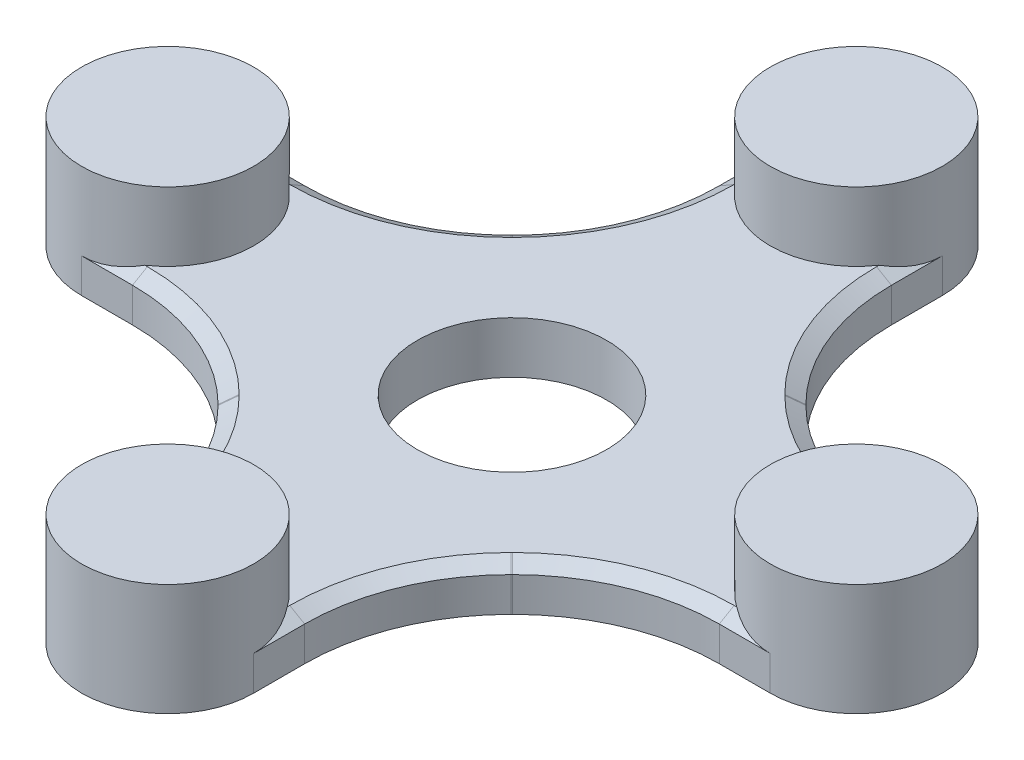
from build123d import *

# Parameters (mm, degrees)
BOSS_EXTRUDE2_DEPTH = 3
SKETCH3_R           = 5
BOSS_EXTRUDE3_DEPTH = 4
FILLET2_R           = 12
CUT_EXTRUDE1_REACH  = 37.581
SKETCH4_R           = 5.5
CHAMFER1_SIZE       = 0.866025404
CHAMFER1_SIZE_2     = 0.5


with BuildPart() as part:
    # Sketch2 → Boss-Extrude2 (new body)
    with BuildSketch(Plane(origin=(0, 0, 0), x_dir=(1, 0, 0), z_dir=(0, 1, 0))):
        Polygon((-5, 25), (-5, 12.071067812), (-12.071067812, 5), (-25, 5), (-25, -5), (-12.071067812, -5), (-5, -12.071067812), (-5, -25), (5, -25), (5, -12.071067812), (12.071067812, -5), (25, -5), (25, 5), (12.071067812, 5), (5, 12.071067812), (5, 25), align=None)
    extrude(amount=BOSS_EXTRUDE2_DEPTH)

    # Sketch3 → Boss-Extrude3 (add)
    with BuildSketch(Plane(origin=(0, 3, 0), x_dir=(1, 0, 0), z_dir=(0, 1, 0))):
        with Locations(Location((-20, 0, 0), (0, 0, 270))):
            Circle(SKETCH3_R)
        with Locations(Location((0, 20, 0), (0, 0, 90))):
            Circle(SKETCH3_R)
        with Locations(Location((20, 0, 0), (0, 0, 270))):
            Circle(SKETCH3_R)
        with Locations(Location((0, -20, 0), (0, 0, 270))):
            Circle(SKETCH3_R)
    extrude(amount=BOSS_EXTRUDE3_DEPTH)

    # Fillet2
    fillet2_edges = [part.edges().sort_by_distance(p)[0] for p in [
        (5, 1.5, -12.071067812),
        (12.071067812, 1.5, -5),
        (12.071067812, 1.5, 5),
        (5, 1.5, 12.071067812),
        (-5, 1.5, 12.071067812),
        (-12.071067812, 1.5, 5),
        (-12.071067812, 1.5, -5),
        (-5, 1.5, -12.071067812),
    ]]
    fillet(fillet2_edges, radius=FILLET2_R)

    # Sketch4 → Cut-Extrude1 (cut, up to next)
    with BuildSketch(Plane(origin=(0, 3, 0), x_dir=(1, 0, 0), z_dir=(0, 1, 0)), mode=Mode.PRIVATE) as cut_extrude1_sk1:
        with BuildLine():
            ThreePointArc((-25, 0), (-23.535533906, -3.535533906), (-20, -5))
            Line((-20, -5), (-25, -5))
            Line((-25, -5), (-25, 0))
        make_face()
    cut_extrude1_tool1 = extrude(cut_extrude1_sk1.sketch, amount=-CUT_EXTRUDE1_REACH, mode=Mode.PRIVATE) & part.part
    # Sketch4 → Cut-Extrude1 (cut, up to next)
    with BuildSketch(Plane(origin=(0, 3, 0), x_dir=(1, 0, 0), z_dir=(0, 1, 0)), mode=Mode.PRIVATE) as cut_extrude1_sk2:
        with BuildLine():
            ThreePointArc((-20, 5), (-23.535533906, 3.535533906), (-25, 0))
            Line((-25, 0), (-25, 5))
            Line((-25, 5), (-20, 5))
        make_face()
    cut_extrude1_tool2 = extrude(cut_extrude1_sk2.sketch, amount=-CUT_EXTRUDE1_REACH, mode=Mode.PRIVATE) & part.part
    # Sketch4 → Cut-Extrude1 (cut, up to next)
    with BuildSketch(Plane(origin=(0, 3, 0), x_dir=(1, 0, 0), z_dir=(0, 1, 0)), mode=Mode.PRIVATE) as cut_extrude1_sk3:
        with BuildLine():
            ThreePointArc((0, 25), (-3.535533906, 23.535533906), (-5, 20))
            Line((-5, 20), (-5, 25))
            Line((-5, 25), (0, 25))
        make_face()
    cut_extrude1_tool3 = extrude(cut_extrude1_sk3.sketch, amount=-CUT_EXTRUDE1_REACH, mode=Mode.PRIVATE) & part.part
    # Sketch4 → Cut-Extrude1 (cut, up to next)
    with BuildSketch(Plane(origin=(0, 3, 0), x_dir=(1, 0, 0), z_dir=(0, 1, 0)), mode=Mode.PRIVATE) as cut_extrude1_sk4:
        with BuildLine():
            ThreePointArc((5, 20), (3.535533906, 23.535533906), (0, 25))
            Line((0, 25), (5, 25))
            Line((5, 25), (5, 20))
        make_face()
    cut_extrude1_tool4 = extrude(cut_extrude1_sk4.sketch, amount=-CUT_EXTRUDE1_REACH, mode=Mode.PRIVATE) & part.part
    # Sketch4 → Cut-Extrude1 (cut, up to next)
    with BuildSketch(Plane(origin=(0, 3, 0), x_dir=(1, 0, 0), z_dir=(0, 1, 0)), mode=Mode.PRIVATE) as cut_extrude1_sk5:
        with BuildLine():
            ThreePointArc((25, 0), (23.535533906, 3.535533906), (20, 5))
            Line((20, 5), (25, 5))
            Line((25, 5), (25, 0))
        make_face()
    cut_extrude1_tool5 = extrude(cut_extrude1_sk5.sketch, amount=-CUT_EXTRUDE1_REACH, mode=Mode.PRIVATE) & part.part
    # Sketch4 → Cut-Extrude1 (cut, up to next)
    with BuildSketch(Plane(origin=(0, 3, 0), x_dir=(1, 0, 0), z_dir=(0, 1, 0)), mode=Mode.PRIVATE) as cut_extrude1_sk6:
        with BuildLine():
            ThreePointArc((20, -5), (23.535533906, -3.535533906), (25, 0))
            Line((25, 0), (25, -5))
            Line((25, -5), (20, -5))
        make_face()
    cut_extrude1_tool6 = extrude(cut_extrude1_sk6.sketch, amount=-CUT_EXTRUDE1_REACH, mode=Mode.PRIVATE) & part.part
    # Sketch4 → Cut-Extrude1 (cut, up to next)
    with BuildSketch(Plane(origin=(0, 3, 0), x_dir=(1, 0, 0), z_dir=(0, 1, 0)), mode=Mode.PRIVATE) as cut_extrude1_sk7:
        with BuildLine():
            ThreePointArc((0, -25), (3.535533906, -23.535533906), (5, -20))
            Line((5, -20), (5, -25))
            Line((5, -25), (0, -25))
        make_face()
    cut_extrude1_tool7 = extrude(cut_extrude1_sk7.sketch, amount=-CUT_EXTRUDE1_REACH, mode=Mode.PRIVATE) & part.part
    # Sketch4 → Cut-Extrude1 (cut, up to next)
    with BuildSketch(Plane(origin=(0, 3, 0), x_dir=(1, 0, 0), z_dir=(0, 1, 0)), mode=Mode.PRIVATE) as cut_extrude1_sk8:
        with BuildLine():
            ThreePointArc((-5, -20), (-3.535533906, -23.535533906), (0, -25))
            Line((0, -25), (-5, -25))
            Line((-5, -25), (-5, -20))
        make_face()
    cut_extrude1_tool8 = extrude(cut_extrude1_sk8.sketch, amount=-CUT_EXTRUDE1_REACH, mode=Mode.PRIVATE) & part.part
    # Sketch4 → Cut-Extrude1 (cut, up to next)
    with BuildSketch(Plane(origin=(0, 3, 0), x_dir=(1, 0, 0), z_dir=(0, 1, 0)), mode=Mode.PRIVATE) as cut_extrude1_sk9:
        with Locations(Location((0, 0, 0), (0, 0, 270))):
            Circle(SKETCH4_R)
    cut_extrude1_tool9 = extrude(cut_extrude1_sk9.sketch, amount=-CUT_EXTRUDE1_REACH, mode=Mode.PRIVATE) & part.part
    add(cut_extrude1_tool1.solids().sort_by_distance((-23.88316, 3, 3.88316))[0], mode=Mode.SUBTRACT)
    add(cut_extrude1_tool2.solids().sort_by_distance((-23.88316, 3, -3.88316))[0], mode=Mode.SUBTRACT)
    add(cut_extrude1_tool3.solids().sort_by_distance((-3.88316, 3, -23.88316))[0], mode=Mode.SUBTRACT)
    add(cut_extrude1_tool4.solids().sort_by_distance((3.88316, 3, -23.88316))[0], mode=Mode.SUBTRACT)
    add(cut_extrude1_tool5.solids().sort_by_distance((23.88316, 3, -3.88316))[0], mode=Mode.SUBTRACT)
    add(cut_extrude1_tool6.solids().sort_by_distance((23.88316, 3, 3.88316))[0], mode=Mode.SUBTRACT)
    add(cut_extrude1_tool7.solids().sort_by_distance((3.88316, 3, 23.88316))[0], mode=Mode.SUBTRACT)
    add(cut_extrude1_tool8.solids().sort_by_distance((-3.88316, 3, 23.88316))[0], mode=Mode.SUBTRACT)
    add(cut_extrude1_tool9.solids().sort_by_distance((0, 3, 0))[0], mode=Mode.SUBTRACT)

    # Chamfer1
    # the kernel refuses this chamfer: 0.866025404, 0.5 mm, written as the material it takes off along each edge
    with BuildSketch(Plane(origin=(17.04163056, 3, 17), x_dir=(-0.7071067811865476, 0, -0.7071067811865475), z_dir=(-0.7071067811865475, 0, 0.7071067811865476))) as chamfer1_piece_1:
        Polygon((12 + CHAMFER1_SIZE, 0), (12, CHAMFER1_SIZE_2), (12, 0), align=None)
    revolve(axis=Axis((17.04163056, 3, 17), (0, -1, 0)), revolution_arc=45, mode=Mode.SUBTRACT)
    with BuildSketch(Plane(origin=(17.04163056, 0, 17), x_dir=(-0.7071067811865476, 0, -0.7071067811865475), z_dir=(-0.7071067811865475, 0, 0.7071067811865476))) as chamfer1_piece_2:
        Polygon((12 + CHAMFER1_SIZE, 0), (12, -CHAMFER1_SIZE_2), (12, 0), align=None)
    revolve(axis=Axis((17.04163056, 0, 17), (0, -1, 0)), revolution_arc=45, mode=Mode.SUBTRACT)
    with BuildSketch(Plane(origin=(17, 0, 17.04163056), x_dir=(-1, 0, 0), z_dir=(0, 0, 1))) as chamfer1_piece_3:
        Polygon((12 + CHAMFER1_SIZE, 0), (12, -CHAMFER1_SIZE_2), (12, 0), align=None)
    revolve(axis=Axis((17, 0, 17.04163056), (0, -1, 0)), revolution_arc=45, mode=Mode.SUBTRACT)
    with BuildSketch(Plane(origin=(17, 3, 17.04163056), x_dir=(-1, 0, 0), z_dir=(0, 0, 1))) as chamfer1_piece_4:
        Polygon((12 + CHAMFER1_SIZE, 0), (12, CHAMFER1_SIZE_2), (12, 0), align=None)
    revolve(axis=Axis((17, 3, 17.04163056), (0, -1, 0)), revolution_arc=45, mode=Mode.SUBTRACT)
    with BuildSketch(Plane(origin=(5, 0, 20), x_dir=(-0.9998132206222079, -0.019326765612700636, 0), z_dir=(0, 0, -1)), Plane(origin=(-20, 0, 5), x_dir=(0, -0.019326765612700636, -0.9998132206222079), z_dir=(1, 0, 0)), Plane(origin=(20, 0, -5), x_dir=(0, -0.019326765612700636, 0.9998132206222079), z_dir=(-1, 0, 0)), Plane(origin=(-5, 0, 17.04163056), x_dir=(0.9998132206222079, -0.019326765612700636, 0), z_dir=(0, 0, 1)), Plane(origin=(-17.04163056, 0, -5), x_dir=(0, -0.019326765612700636, 0.9998132206222079), z_dir=(-1, 0, 0)), Plane(origin=(5, 0, -17.04163056), x_dir=(-0.9998132206222079, -0.019326765612700636, 0), z_dir=(0, 0, -1)), Plane(origin=(17.04163056, 0, 5), x_dir=(0, -0.019326765612700636, -0.9998132206222079), z_dir=(1, 0, 0))) as chamfer1_piece_5:
        Polygon((CHAMFER1_SIZE * 0.999813220373, CHAMFER1_SIZE * 0.0193267656079), (-CHAMFER1_SIZE_2 * 0.0193267656127, CHAMFER1_SIZE_2 * 0.999813220622), (0, 0), align=None)
    extrude(amount=2.95836944, mode=Mode.SUBTRACT)
    with BuildSketch(Plane(origin=(5, 3, 22.240481985), x_dir=(-0.9998132206222079, 0.019326765612700702, 0), z_dir=(0, 0, -1))) as chamfer1_piece_6_section:
        Polygon((CHAMFER1_SIZE * 0.999813220373, -CHAMFER1_SIZE * 0.0193267656079), (-CHAMFER1_SIZE_2 * 0.0193267656127, -CHAMFER1_SIZE_2 * 0.999813220622), (0, 0), align=None)
    chamfer1_piece_6 = extrude(amount=5.198851425, mode=Mode.PRIVATE)
    chamfer1_piece_6 = chamfer1_piece_6 - Plane(origin=(0, 2.808146468, 20), x_dir=(0, 0, 1), z_dir=(0, 1, 0)) * Cylinder(5, 14, mode=Mode.PRIVATE)
    add(chamfer1_piece_6, mode=Mode.SUBTRACT)
    with BuildSketch(Plane(origin=(-5, 0, -20), x_dir=(-0.057893862402671484, 0.9983227437537926, 0), z_dir=(0, 0, 1))) as chamfer1_piece_7:
        Polygon((CHAMFER1_SIZE_2 * 0.998322743754, -CHAMFER1_SIZE_2 * 0.0578938624027), (-CHAMFER1_SIZE * 0.0578938623883, -CHAMFER1_SIZE * 0.998322743505), (0, 0), align=None)
    extrude(amount=2.95836944, mode=Mode.SUBTRACT)
    with BuildSketch(Plane(origin=(-5, 3, -22.240481983), x_dir=(-0.05789386240267147, -0.9983227437537926, 0), z_dir=(0, 0, 1))) as chamfer1_piece_8_section:
        Polygon((CHAMFER1_SIZE_2 * 0.998322743754, CHAMFER1_SIZE_2 * 0.0578938624027), (-CHAMFER1_SIZE * 0.0578938623883, CHAMFER1_SIZE * 0.998322743505), (0, 0), align=None)
    chamfer1_piece_8 = extrude(amount=5.198851422, mode=Mode.PRIVATE)
    chamfer1_piece_8 = chamfer1_piece_8 - Plane(origin=(0, 2.808146468, -20), x_dir=(0, 0, -1), z_dir=(0, 1, 0)) * Cylinder(5, 14, mode=Mode.PRIVATE)
    add(chamfer1_piece_8, mode=Mode.SUBTRACT)
    with BuildSketch(Plane(origin=(0, 0, 20), x_dir=(-1, 0, 0), z_dir=(0, 0, -1))) as chamfer1_piece_9:
        Polygon((5 - CHAMFER1_SIZE, 0), (5, CHAMFER1_SIZE_2), (5, 0), align=None)
    revolve(axis=Axis((0, 0, 20), (0, 1, 0)), revolution_arc=90, mode=Mode.SUBTRACT)
    with BuildSketch(Plane(origin=(20, 0, 0), x_dir=(0, 0, 1), z_dir=(-1, 0, 0))) as chamfer1_piece_10:
        Polygon((5 - CHAMFER1_SIZE, 0), (5, CHAMFER1_SIZE_2), (5, 0), align=None)
    revolve(axis=Axis((20, 0, 0), (0, 1, 0)), revolution_arc=90, mode=Mode.SUBTRACT)
    with BuildSketch(Plane(origin=(0, 0, -20), x_dir=(1, 0, 0), z_dir=(0, 0, 1))) as chamfer1_piece_11:
        Polygon((5 - CHAMFER1_SIZE, 0), (5, CHAMFER1_SIZE_2), (5, 0), align=None)
    revolve(axis=Axis((0, 0, -20), (0, 1, 0)), revolution_arc=90, mode=Mode.SUBTRACT)
    with BuildSketch(Plane(origin=(-20, 0, 0), x_dir=(0, 0, -1), z_dir=(1, 0, 0))) as chamfer1_piece_12:
        Polygon((5 - CHAMFER1_SIZE, 0), (5, CHAMFER1_SIZE_2), (5, 0), align=None)
    revolve(axis=Axis((-20, 0, 0), (0, 1, 0)), revolution_arc=90, mode=Mode.SUBTRACT)
    with BuildSketch(Plane(origin=(-22.240481985, 3, 5), x_dir=(0, 0.019326765612700702, -0.9998132206222079), z_dir=(1, 0, 0))) as chamfer1_piece_13_section:
        Polygon((CHAMFER1_SIZE * 0.999813220373, -CHAMFER1_SIZE * 0.0193267656079), (-CHAMFER1_SIZE_2 * 0.0193267656127, -CHAMFER1_SIZE_2 * 0.999813220622), (0, 0), align=None)
    chamfer1_piece_13 = extrude(amount=5.198851425, mode=Mode.PRIVATE)
    chamfer1_piece_13 = chamfer1_piece_13 - Plane(origin=(-20, 2.808146468, 0), x_dir=(-1, 0, 0), z_dir=(0, 1, 0)) * Cylinder(5, 14, mode=Mode.PRIVATE)
    add(chamfer1_piece_13, mode=Mode.SUBTRACT)
    with BuildSketch(Plane(origin=(22.240481985, 3, -5), x_dir=(0, 0.019326765612700702, 0.9998132206222079), z_dir=(-1, 0, 0))) as chamfer1_piece_14_section:
        Polygon((CHAMFER1_SIZE * 0.999813220373, -CHAMFER1_SIZE * 0.0193267656079), (-CHAMFER1_SIZE_2 * 0.0193267656127, -CHAMFER1_SIZE_2 * 0.999813220622), (0, 0), align=None)
    chamfer1_piece_14 = extrude(amount=5.198851425, mode=Mode.PRIVATE)
    chamfer1_piece_14 = chamfer1_piece_14 - Plane(origin=(20, 2.808146468, 0), x_dir=(1, 0, 0), z_dir=(0, 1, 0)) * Cylinder(5, 14, mode=Mode.PRIVATE)
    add(chamfer1_piece_14, mode=Mode.SUBTRACT)
    with BuildSketch(Plane(origin=(-8.556349186, 0, 8.514718626), x_dir=(0.7069747082219248, -0.01932676561270064, -0.7069747082219251), z_dir=(0.7071067811865477, 0, 0.7071067811865475)), Plane(origin=(-8.514718626, 0, -8.556349186), x_dir=(0.706974708221925, -0.01932676561270064, 0.706974708221925), z_dir=(-0.7071067811865475, 0, 0.7071067811865476)), Plane(origin=(8.556349186, 0, -8.514718626), x_dir=(-0.706974708221925, -0.01932676561270064, 0.706974708221925), z_dir=(-0.7071067811865476, 0, -0.7071067811865476)), Plane(origin=(8.514718626, 0, 8.556349186), x_dir=(-0.7069747082219248, -0.01932676561270064, -0.7069747082219251), z_dir=(0.7071067811865477, 0, -0.7071067811865475))) as chamfer1_piece_15:
        Polygon((CHAMFER1_SIZE * 0.999813220373, CHAMFER1_SIZE * 0.0193267656079), (-CHAMFER1_SIZE_2 * 0.0193267656127, CHAMFER1_SIZE_2 * 0.999813220622), (0, 0), align=None)
    extrude(amount=0.058874503, mode=Mode.SUBTRACT)
    with BuildSketch(Plane(origin=(-8.556349186, 3, 8.514718626), x_dir=(0.7069747082219248, 0.019326765612700702, -0.7069747082219251), z_dir=(0.7071067811865477, 0, 0.7071067811865475)), Plane(origin=(-8.514718626, 3, -8.556349186), x_dir=(0.706974708221925, 0.019326765612700702, 0.706974708221925), z_dir=(-0.7071067811865475, 0, 0.7071067811865476)), Plane(origin=(8.556349186, 3, -8.514718626), x_dir=(-0.706974708221925, 0.019326765612700702, 0.706974708221925), z_dir=(-0.7071067811865476, 0, -0.7071067811865476)), Plane(origin=(8.514718626, 3, 8.556349186), x_dir=(-0.7069747082219248, 0.019326765612700702, -0.7069747082219251), z_dir=(0.7071067811865477, 0, -0.7071067811865475))) as chamfer1_piece_16:
        Polygon((CHAMFER1_SIZE * 0.999813220373, -CHAMFER1_SIZE * 0.0193267656079), (-CHAMFER1_SIZE_2 * 0.0193267656127, -CHAMFER1_SIZE_2 * 0.999813220622), (0, 0), align=None)
    extrude(amount=0.058874503, mode=Mode.SUBTRACT)
    with BuildSketch(Plane(origin=(-5, 3, 17.04163056), x_dir=(0.9998132206222079, 0.019326765612700702, 0), z_dir=(0, 0, 1))) as chamfer1_piece_17_section:
        Polygon((CHAMFER1_SIZE * 0.999813220373, -CHAMFER1_SIZE * 0.0193267656079), (-CHAMFER1_SIZE_2 * 0.0193267656127, -CHAMFER1_SIZE_2 * 0.999813220622), (0, 0), align=None)
    chamfer1_piece_17 = extrude(amount=5.198851425, mode=Mode.PRIVATE)
    chamfer1_piece_17 = chamfer1_piece_17 - Plane(origin=(0, 2.808146468, 20), x_dir=(-1, 0, 0), z_dir=(0, 1, 0)) * Cylinder(5, 14, mode=Mode.PRIVATE)
    add(chamfer1_piece_17, mode=Mode.SUBTRACT)
    with BuildSketch(Plane(origin=(-17.04163056, 3, -5), x_dir=(0, 0.019326765612700702, 0.9998132206222079), z_dir=(-1, 0, 0))) as chamfer1_piece_18_section:
        Polygon((CHAMFER1_SIZE * 0.999813220373, -CHAMFER1_SIZE * 0.0193267656079), (-CHAMFER1_SIZE_2 * 0.0193267656127, -CHAMFER1_SIZE_2 * 0.999813220622), (0, 0), align=None)
    chamfer1_piece_18 = extrude(amount=5.198851425, mode=Mode.PRIVATE)
    chamfer1_piece_18 = chamfer1_piece_18 - Plane(origin=(-20, 2.808146468, 0), x_dir=(0, 0, -1), z_dir=(0, 1, 0)) * Cylinder(5, 14, mode=Mode.PRIVATE)
    add(chamfer1_piece_18, mode=Mode.SUBTRACT)
    with BuildSketch(Plane(origin=(5, 3, -17.04163056), x_dir=(-0.9998132206222079, 0.019326765612700702, 0), z_dir=(0, 0, -1))) as chamfer1_piece_19_section:
        Polygon((CHAMFER1_SIZE * 0.999813220373, -CHAMFER1_SIZE * 0.0193267656079), (-CHAMFER1_SIZE_2 * 0.0193267656127, -CHAMFER1_SIZE_2 * 0.999813220622), (0, 0), align=None)
    chamfer1_piece_19 = extrude(amount=5.198851425, mode=Mode.PRIVATE)
    chamfer1_piece_19 = chamfer1_piece_19 - Plane(origin=(0, 2.808146468, -20), x_dir=(1, 0, 0), z_dir=(0, 1, 0)) * Cylinder(5, 14, mode=Mode.PRIVATE)
    add(chamfer1_piece_19, mode=Mode.SUBTRACT)
    with BuildSketch(Plane(origin=(17.04163056, 3, 5), x_dir=(0, 0.019326765612700702, -0.9998132206222079), z_dir=(1, 0, 0))) as chamfer1_piece_20_section:
        Polygon((CHAMFER1_SIZE * 0.999813220373, -CHAMFER1_SIZE * 0.0193267656079), (-CHAMFER1_SIZE_2 * 0.0193267656127, -CHAMFER1_SIZE_2 * 0.999813220622), (0, 0), align=None)
    chamfer1_piece_20 = extrude(amount=5.198851425, mode=Mode.PRIVATE)
    chamfer1_piece_20 = chamfer1_piece_20 - Plane(origin=(20, 2.808146468, 0), x_dir=(0, 0, 1), z_dir=(0, 1, 0)) * Cylinder(5, 14, mode=Mode.PRIVATE)
    add(chamfer1_piece_20, mode=Mode.SUBTRACT)
    with BuildSketch(Plane(origin=(-17.04163056, 0, 17), x_dir=(0, 0, -1), z_dir=(-1, 0, 0))) as chamfer1_piece_21:
        Polygon((12 + CHAMFER1_SIZE, 0), (12, -CHAMFER1_SIZE_2), (12, 0), align=None)
    revolve(axis=Axis((-17.04163056, 0, 17), (0, -1, 0)), revolution_arc=45, mode=Mode.SUBTRACT)
    with BuildSketch(Plane(origin=(-17.04163056, 3, 17), x_dir=(0, 0, -1), z_dir=(-1, 0, 0))) as chamfer1_piece_22:
        Polygon((12 + CHAMFER1_SIZE, 0), (12, CHAMFER1_SIZE_2), (12, 0), align=None)
    revolve(axis=Axis((-17.04163056, 3, 17), (0, -1, 0)), revolution_arc=45, mode=Mode.SUBTRACT)
    with BuildSketch(Plane(origin=(-17, 0, 17.04163056), x_dir=(0.7071067811865475, 0, -0.7071067811865476), z_dir=(-0.7071067811865476, 0, -0.7071067811865475))) as chamfer1_piece_23:
        Polygon((12 + CHAMFER1_SIZE, 0), (12, -CHAMFER1_SIZE_2), (12, 0), align=None)
    revolve(axis=Axis((-17, 0, 17.04163056), (0, -1, 0)), revolution_arc=45, mode=Mode.SUBTRACT)
    with BuildSketch(Plane(origin=(-17, 3, 17.04163056), x_dir=(0.7071067811865475, 0, -0.7071067811865476), z_dir=(-0.7071067811865476, 0, -0.7071067811865475))) as chamfer1_piece_24:
        Polygon((12 + CHAMFER1_SIZE, 0), (12, CHAMFER1_SIZE_2), (12, 0), align=None)
    revolve(axis=Axis((-17, 3, 17.04163056), (0, -1, 0)), revolution_arc=45, mode=Mode.SUBTRACT)
    with BuildSketch(Plane(origin=(-17.04163056, 0, -17), x_dir=(0.7071067811865477, 0, 0.7071067811865475), z_dir=(0.7071067811865475, 0, -0.7071067811865477))) as chamfer1_piece_25:
        Polygon((12 + CHAMFER1_SIZE, 0), (12, -CHAMFER1_SIZE_2), (12, 0), align=None)
    revolve(axis=Axis((-17.04163056, 0, -17), (0, -1, 0)), revolution_arc=45, mode=Mode.SUBTRACT)
    with BuildSketch(Plane(origin=(-17.04163056, 3, -17), x_dir=(0.7071067811865477, 0, 0.7071067811865475), z_dir=(0.7071067811865475, 0, -0.7071067811865477))) as chamfer1_piece_26:
        Polygon((12 + CHAMFER1_SIZE, 0), (12, CHAMFER1_SIZE_2), (12, 0), align=None)
    revolve(axis=Axis((-17.04163056, 3, -17), (0, -1, 0)), revolution_arc=45, mode=Mode.SUBTRACT)
    with BuildSketch(Plane(origin=(-17, 0, -17.04163056), x_dir=(1, 0, 0), z_dir=(0, 0, -1))) as chamfer1_piece_27:
        Polygon((12 + CHAMFER1_SIZE, 0), (12, -CHAMFER1_SIZE_2), (12, 0), align=None)
    revolve(axis=Axis((-17, 0, -17.04163056), (0, -1, 0)), revolution_arc=45, mode=Mode.SUBTRACT)
    with BuildSketch(Plane(origin=(-17, 3, -17.04163056), x_dir=(1, 0, 0), z_dir=(0, 0, -1))) as chamfer1_piece_28:
        Polygon((12, CHAMFER1_SIZE_2), (12 + CHAMFER1_SIZE, 0), (12, 0), align=None)
    revolve(axis=Axis((-17, 3, -17.04163056), (0, -1, 0)), revolution_arc=45, mode=Mode.SUBTRACT)
    with BuildSketch(Plane(origin=(17, 0, -17.04163056), x_dir=(-1, 0, 0), z_dir=(0, 0, -1))) as chamfer1_piece_29:
        Polygon((12 + CHAMFER1_SIZE, 0), (12, CHAMFER1_SIZE_2), (12, 0), align=None)
    revolve(axis=Axis((17, 0, -17.04163056), (0, 1, 0)), revolution_arc=45, mode=Mode.SUBTRACT)
    with BuildSketch(Plane(origin=(17, 3, -17.04163056), x_dir=(-1, 0, 0), z_dir=(0, 0, -1))) as chamfer1_piece_30:
        Polygon((12 + CHAMFER1_SIZE, 0), (12, -CHAMFER1_SIZE_2), (12, 0), align=None)
    revolve(axis=Axis((17, 3, -17.04163056), (0, 1, 0)), revolution_arc=45, mode=Mode.SUBTRACT)
    with BuildSketch(Plane(origin=(17.04163056, 0, -17), x_dir=(0, 0, 1), z_dir=(1, 0, 0))) as chamfer1_piece_31:
        Polygon((12 + CHAMFER1_SIZE, 0), (12, -CHAMFER1_SIZE_2), (12, 0), align=None)
    revolve(axis=Axis((17.04163056, 0, -17), (0, -1, 0)), revolution_arc=45, mode=Mode.SUBTRACT)
    with BuildSketch(Plane(origin=(17.04163056, 3, -17), x_dir=(0, 0, 1), z_dir=(1, 0, 0))) as chamfer1_piece_32:
        Polygon((12 + CHAMFER1_SIZE, 0), (12, CHAMFER1_SIZE_2), (12, 0), align=None)
    revolve(axis=Axis((17.04163056, 3, -17), (0, -1, 0)), revolution_arc=45, mode=Mode.SUBTRACT)
    with BuildSketch(Plane(origin=(20, 0, 0), x_dir=(1, 0, 0), z_dir=(0, 0, 1))) as chamfer1_piece_33:
        Polygon((5 - CHAMFER1_SIZE, 0), (5, CHAMFER1_SIZE_2), (5, 0), align=None)
    revolve(axis=Axis((20, 0, 0), (0, 1, 0)), revolution_arc=90, mode=Mode.SUBTRACT)
    with BuildSketch(Plane(origin=(-20, 0, 0), x_dir=(-1, 0, 0), z_dir=(0, 0, -1))) as chamfer1_piece_34:
        Polygon((5 - CHAMFER1_SIZE, 0), (5, CHAMFER1_SIZE_2), (5, 0), align=None)
    revolve(axis=Axis((-20, 0, 0), (0, 1, 0)), revolution_arc=90, mode=Mode.SUBTRACT)
    with BuildSketch(Plane(origin=(0, 0, -20), x_dir=(0, 0, -1), z_dir=(1, 0, 0))) as chamfer1_piece_35:
        Polygon((5 - CHAMFER1_SIZE, 0), (5, CHAMFER1_SIZE_2), (5, 0), align=None)
    revolve(axis=Axis((0, 0, -20), (0, 1, 0)), revolution_arc=90, mode=Mode.SUBTRACT)
    with BuildSketch(Plane(origin=(0, 0, 20), x_dir=(0, 0, 1), z_dir=(-1, 0, 0))) as chamfer1_piece_36:
        Polygon((5 - CHAMFER1_SIZE, 0), (5, CHAMFER1_SIZE_2), (5, 0), align=None)
    revolve(axis=Axis((0, 0, 20), (0, 1, 0)), revolution_arc=90, mode=Mode.SUBTRACT)


solid = part.part
